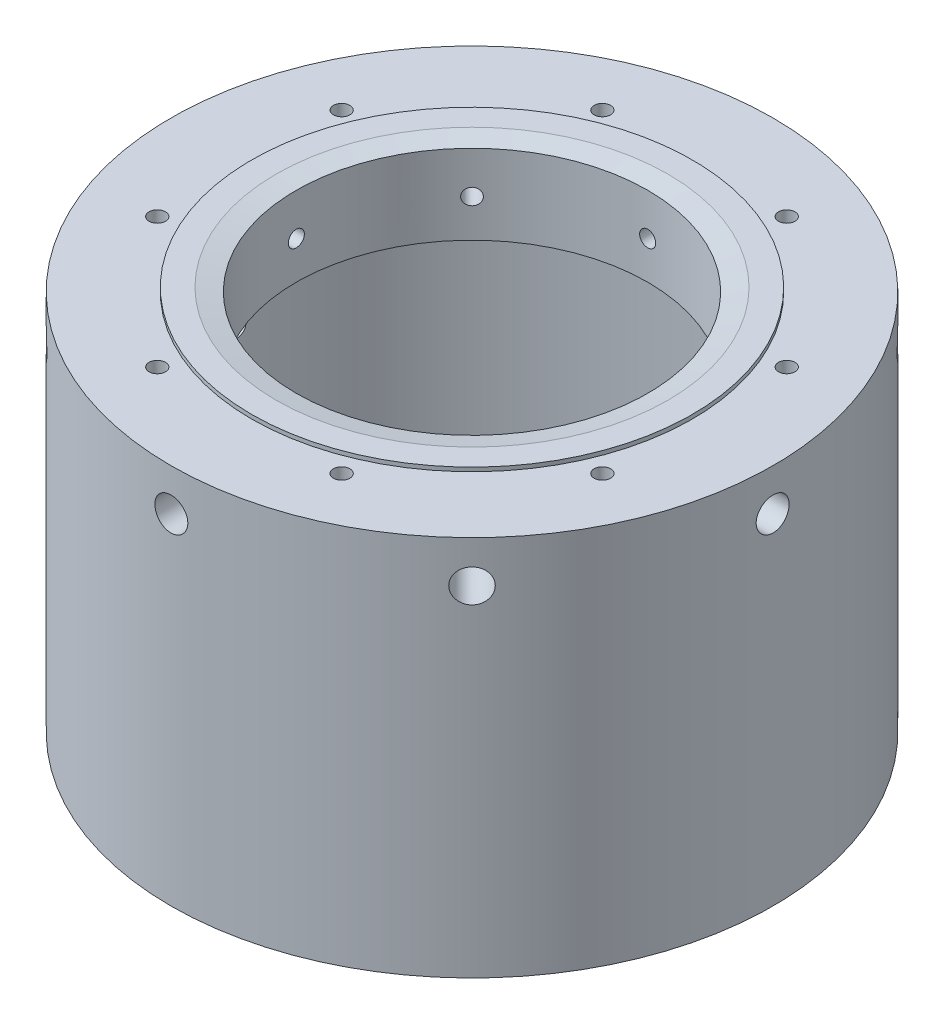
from build123d import *

# Parameters (mm, degrees)
CUT_EXTRUDE10_REACH             = 194.743
SKETCH8_R                       = 2
CUT_EXTRUDE10_DIRECTION_2_DEPTH = 193.743352674
SKETCH9_R                       = 4.1
CUT_EXTRUDE11_DEPTH             = 25.4
CUT_EXTRUDE7_START              = -19.833333
SKETCH6_R                       = 2.05
CUT_EXTRUDE7_DEPTH              = 15
CUT_EXTRUDE9_REACH              = 144.39
SKETCH7_R                       = 2.05
CIRPATTERN5_COUNT               = 8
BOSS_EXTRUDE4_OUTLINE_R         = 54.9
BOSS_EXTRUDE4_OUTLINE_R_2       = 43.8
BOSS_EXTRUDE4_DEPTH             = 1
CHAMFER1_SIZE                   = 5
CHAMFER1_SIZE_2                 = 1
CUT_EXTRUDE15_REACH             = 145.059
CUT_EXTRUDE15_END_RADIUS        = 75
SKETCH24_R                      = 2.55
CUT_EXTRUDE16_REACH             = 345.059
CUT_EXTRUDE16_END_RADIUS        = 74
CUT_EXTRUDE16_START             = -200
SKETCH25_R                      = 5.1
SKETCH25_R_2                    = 2.55
CUT_EXTRUDE17_DEPTH             = 3.3
CUT_EXTRUDE18_REACH             = 139.819
SKETCH27_R                      = 2.05
CIRPATTERN25_COUNT              = 12
CUT_EXTRUDE19_REACH             = 195.238
CUT_EXTRUDE19_END_RADIUS        = 70
SKETCH31_W                      = 2.5
SKETCH31_H                      = 5
CIRPATTERN26_COUNT              = 8
CUT_EXTRUDE20_DEPTH             = 2.5
SKETCH34_R                      = 1.55
CUT_EXTRUDE21_DEPTH             = 140.428297093


# Read off the part's stored shape, not the designer's step: Boss-Extrude4
with BuildPart() as part:
    # Sketch1 → Revolve1 (revolve)
    with BuildSketch(Plane(origin=(0, 0, 0), x_dir=(0, 0, -1), z_dir=(1, 0, 0))):
        Polygon((75, 0), (75, 95), (43.8, 95), (43.8, 75.166667), (70, 75.166667), (70, 8), (50, 8), (50, 0), align=None)
    revolve(axis=Axis((0, 0, 0), (0, 1, 0)))

    # Sketch8 → Cut-Extrude10 (cut, up to next)
    with BuildSketch(Plane(origin=(0, 0, -75), x_dir=(-1, 0, 0), z_dir=(0, 0, -1)), mode=Mode.PRIVATE) as cut_extrude10_sk1:
        with Locations(Location((0, 84.586667, 0), (0, 0, 270.000000054))):
            Circle(SKETCH8_R)
    cut_extrude10_tool1 = extrude(cut_extrude10_sk1.sketch, amount=-CUT_EXTRUDE10_REACH, mode=Mode.PRIVATE) & part.part
    cut_extrude10 = cut_extrude10_tool1.solids().sort_by_distance((0, 84.586667, -75))[0]
    add(cut_extrude10, mode=Mode.SUBTRACT)

    # Sketch8 → Cut-Extrude10 direction 2 (cut)
    with BuildSketch(Plane(origin=(0, 0, -75), x_dir=(-1, 0, 0), z_dir=(0, 0, -1))):
        with Locations(Location((0, 84.586667, 0), (0, 0, 270.000000054))):
            Circle(SKETCH8_R)
    cut_extrude10_direction_2 = extrude(amount=CUT_EXTRUDE10_DIRECTION_2_DEPTH, mode=Mode.SUBTRACT)

    # Sketch9 → Cut-Extrude11 (cut)
    with BuildSketch(Plane(origin=(0, 0, -75), x_dir=(-1, 0, 0), z_dir=(0, 0, -1))):
        with Locations((0, 84.586667)):
            Circle(SKETCH9_R)
    cut_extrude11 = extrude(amount=-CUT_EXTRUDE11_DEPTH, mode=Mode.SUBTRACT)

    # Sketch6 → Cut-Extrude7 (cut)
    with BuildSketch(Plane(origin=(0, 95, 0), x_dir=(1, 0, 0), z_dir=(0, 1, 0)).offset(CUT_EXTRUDE7_START)):
        Polygon((-19.740216226, 52.897057665), (-19.154618096, 56.954200522), (-22.375407812, 59.489914808), (-26.181795658, 57.968486236), (-26.767393788, 53.911343379), (-23.546604072, 51.375629094), align=None)
        with Locations(Location((-22.961005942, 55.432771951, 0), (0, 0, 90))):
            Circle(SKETCH6_R, mode=Mode.SUBTRACT)
    cut_extrude7 = extrude(amount=CUT_EXTRUDE7_DEPTH, mode=Mode.SUBTRACT)

    # Sketch7 → Cut-Extrude9 (cut, up to next)
    with BuildSketch(Plane(origin=(0, 95, 0), x_dir=(1, 0, 0), z_dir=(0, 1, 0)), mode=Mode.PRIVATE) as cut_extrude9_sk1:
        with Locations(Location((-22.961005942, 55.432771951, 0), (0, 0, 270))):
            Circle(SKETCH7_R)
    cut_extrude9_tool1 = extrude(cut_extrude9_sk1.sketch, amount=-CUT_EXTRUDE9_REACH, mode=Mode.PRIVATE) & part.part
    cut_extrude9 = cut_extrude9_tool1.solids().sort_by_distance((-22.961006, 95, -55.432772))[0]
    add(cut_extrude9, mode=Mode.SUBTRACT)

    # CirPattern5: Cut-Extrude10, Cut-Extrude10 direction 2, Cut-Extrude11 ×8 about axis
    cirpattern5_axis = Axis((0, 0, 0), (0, 1, 0))
    add([cut_extrude10.rotate(cirpattern5_axis, i * 360 / CIRPATTERN5_COUNT) for i in range(1, CIRPATTERN5_COUNT)], mode=Mode.SUBTRACT)
    add([cut_extrude10_direction_2.rotate(cirpattern5_axis, i * 360 / CIRPATTERN5_COUNT) for i in range(1, CIRPATTERN5_COUNT)], mode=Mode.SUBTRACT)
    add([cut_extrude11.rotate(cirpattern5_axis, i * 360 / CIRPATTERN5_COUNT) for i in range(1, CIRPATTERN5_COUNT)], mode=Mode.SUBTRACT)

    # Boss-Extrude4 outline → Boss-Extrude4 (add)
    with BuildSketch(Plane(origin=(0, 95, 0), x_dir=(1, 0, 0), z_dir=(0, 1, 0))):
        Circle(BOSS_EXTRUDE4_OUTLINE_R)
        Circle(BOSS_EXTRUDE4_OUTLINE_R_2, mode=Mode.SUBTRACT)
    extrude(amount=BOSS_EXTRUDE4_DEPTH)

    # Chamfer1
    # the kernel refuses this chamfer: 5, 1 mm, written as the material it takes off along each edge
    with BuildSketch(Plane(origin=(0, 96, 0), x_dir=(1, 0, 0), z_dir=(0, 0, 1))) as chamfer1_piece_1:
        Polygon((43.8 + CHAMFER1_SIZE, 0), (43.8, -CHAMFER1_SIZE_2), (43.8, 0), align=None)
    revolve(axis=Axis((0, 96, 0), (0, 1, 0)), mode=Mode.SUBTRACT)

    # Cut-Extrude15: up to this cylinder (the profile starts inside it)
    cut_extrude15_end = Plane(origin=(0, 47.5, 0), z_dir=(0, -1, 0)) * Cylinder(CUT_EXTRUDE15_END_RADIUS, 441.118, mode=Mode.PRIVATE)
    # Sketch24 → Cut-Extrude15 (cut, up to the surface)
    with BuildSketch(Plane(origin=(0, 0, 0), x_dir=(0, 0, -1), z_dir=(1, 0, 0)), mode=Mode.PRIVATE) as cut_extrude15_sk1:
        with Locations((-10, 47.5)):
            Circle(SKETCH24_R)
    cut_extrude15_tool1 = extrude(cut_extrude15_sk1.sketch, amount=-CUT_EXTRUDE15_REACH, mode=Mode.PRIVATE) & cut_extrude15_end
    add(cut_extrude15_tool1.solids().sort_by_distance((0, 47.5, 10))[0], mode=Mode.SUBTRACT)
    # Sketch24 → Cut-Extrude15 (cut, up to the surface)
    with BuildSketch(Plane(origin=(0, 0, 0), x_dir=(0, 0, -1), z_dir=(1, 0, 0)), mode=Mode.PRIVATE) as cut_extrude15_sk2:
        with Locations((10, 47.5)):
            Circle(SKETCH24_R)
    cut_extrude15_tool2 = extrude(cut_extrude15_sk2.sketch, amount=-CUT_EXTRUDE15_REACH, mode=Mode.PRIVATE) & cut_extrude15_end
    add(cut_extrude15_tool2.solids().sort_by_distance((0, 47.5, -10))[0], mode=Mode.SUBTRACT)

    # Cut-Extrude16: up to this cylinder (the profile starts outside it)
    cut_extrude16_end = Plane(origin=(0, 47.5, 0), z_dir=(0, -1, 0)) * Cylinder(CUT_EXTRUDE16_END_RADIUS, 839.118, mode=Mode.PRIVATE)
    # Sketch25 → Cut-Extrude16 (cut, up to the surface)
    with BuildSketch(Plane(origin=(0, 0, 0), x_dir=(0, 0, -1), z_dir=(1, 0, 0)).offset(CUT_EXTRUDE16_START), mode=Mode.PRIVATE) as cut_extrude16_sk1:
        with Locations(Location((10, 47.5, 0), (0, 0, 180))):
            Circle(SKETCH25_R)
        with Locations((10, 47.5)):
            Circle(SKETCH25_R_2, mode=Mode.SUBTRACT)
    cut_extrude16_tool1 = extrude(cut_extrude16_sk1.sketch, amount=CUT_EXTRUDE16_REACH, mode=Mode.PRIVATE) - cut_extrude16_end
    add(cut_extrude16_tool1.solids().sort_by_distance((-200, 47.5, -14.95575))[0], mode=Mode.SUBTRACT)
    # Sketch25 → Cut-Extrude16 (cut, up to the surface)
    with BuildSketch(Plane(origin=(0, 0, 0), x_dir=(0, 0, -1), z_dir=(1, 0, 0)).offset(CUT_EXTRUDE16_START), mode=Mode.PRIVATE) as cut_extrude16_sk2:
        with Locations(Location((-10, 47.5, 0), (0, 0, 180))):
            Circle(SKETCH25_R)
    cut_extrude16_tool2 = extrude(cut_extrude16_sk2.sketch, amount=CUT_EXTRUDE16_REACH, mode=Mode.PRIVATE) - cut_extrude16_end
    add(cut_extrude16_tool2.solids().sort_by_distance((-200, 47.5, 10))[0], mode=Mode.SUBTRACT)

    # Sketch26 → Cut-Extrude17 (cut)
    with BuildSketch(Plane(origin=(0, 8, 0), x_dir=(1, 0, 0), z_dir=(0, 1, 0))):
        Polygon((-24.149252646, 51.509584076), (-20.15754893, 52.442126181), (-18.969302226, 56.365314057), (-21.772759238, 59.355959826), (-25.764462954, 58.42341772), (-26.952709658, 54.500229845), align=None)
    cut_extrude17 = extrude(amount=-CUT_EXTRUDE17_DEPTH, mode=Mode.SUBTRACT)

    # Sketch27 → Cut-Extrude18 (cut, up to next)
    with BuildSketch(Plane(origin=(0, 8, 0), x_dir=(1, 0, 0), z_dir=(0, 1, 0)), mode=Mode.PRIVATE) as cut_extrude18_sk1:
        with Locations(Location((-22.961005942, 55.432771951, 0), (0, 0, 270))):
            Circle(SKETCH27_R)
    cut_extrude18_tool1 = extrude(cut_extrude18_sk1.sketch, amount=-CUT_EXTRUDE18_REACH, mode=Mode.PRIVATE) & part.part
    cut_extrude18 = cut_extrude18_tool1.solids().sort_by_distance((-22.961006, 8, -55.432772))[0]
    add(cut_extrude18, mode=Mode.SUBTRACT)

    # CirPattern25: Cut-Extrude17, Cut-Extrude18 ×12 about axis
    cirpattern25_axis = Axis((0, 0, 0), (0, 1, 0))
    add([cut_extrude17.rotate(cirpattern25_axis, i * 360 / CIRPATTERN25_COUNT) for i in range(1, CIRPATTERN25_COUNT)], mode=Mode.SUBTRACT)
    add([cut_extrude18.rotate(cirpattern25_axis, i * 360 / CIRPATTERN25_COUNT) for i in range(1, CIRPATTERN25_COUNT)], mode=Mode.SUBTRACT)

    # Cut-Extrude19: up to this cylinder (the profile starts outside it)
    cut_extrude19_end = Plane(origin=(0, 43.125, 0), z_dir=(0, -1, 0)) * Cylinder(CUT_EXTRUDE19_END_RADIUS, 575.226, mode=Mode.PRIVATE)
    # Sketch31 → Cut-Extrude19 (cut, up to the surface)
    with BuildSketch(Plane(origin=(0, 0, -75), x_dir=(-1, 0, 0), z_dir=(0, 0, -1)), mode=Mode.PRIVATE) as cut_extrude19_sk1:
        with Locations((-13.75, 65)):
            Rectangle(SKETCH31_W, SKETCH31_H)
    cut_extrude19_tool1 = extrude(cut_extrude19_sk1.sketch, amount=-CUT_EXTRUDE19_REACH, mode=Mode.PRIVATE) - cut_extrude19_end
    add(cut_extrude19_tool1.solids().sort_by_distance((13.75, 65, -75))[0], mode=Mode.SUBTRACT)
    # Sketch31 → Cut-Extrude19 (cut, up to the surface)
    with BuildSketch(Plane(origin=(0, 0, -75), x_dir=(-1, 0, 0), z_dir=(0, 0, -1)), mode=Mode.PRIVATE) as cut_extrude19_sk2:
        with Locations((13.75, 65)):
            Rectangle(SKETCH31_W, SKETCH31_H)
    cut_extrude19_tool2 = extrude(cut_extrude19_sk2.sketch, amount=-CUT_EXTRUDE19_REACH, mode=Mode.PRIVATE) - cut_extrude19_end
    add(cut_extrude19_tool2.solids().sort_by_distance((-13.75, 65, -75))[0], mode=Mode.SUBTRACT)
    # Sketch31 → Cut-Extrude19 (cut, up to the surface)
    with BuildSketch(Plane(origin=(0, 0, -75), x_dir=(-1, 0, 0), z_dir=(0, 0, -1)), mode=Mode.PRIVATE) as cut_extrude19_sk3:
        with Locations((-13.75, 21.25)):
            Rectangle(SKETCH31_W, SKETCH31_H)
    cut_extrude19_tool3 = extrude(cut_extrude19_sk3.sketch, amount=-CUT_EXTRUDE19_REACH, mode=Mode.PRIVATE) - cut_extrude19_end
    add(cut_extrude19_tool3.solids().sort_by_distance((13.75, 21.25, -75))[0], mode=Mode.SUBTRACT)
    # Sketch31 → Cut-Extrude19 (cut, up to the surface)
    with BuildSketch(Plane(origin=(0, 0, -75), x_dir=(-1, 0, 0), z_dir=(0, 0, -1)), mode=Mode.PRIVATE) as cut_extrude19_sk4:
        with Locations((13.75, 21.25)):
            Rectangle(SKETCH31_W, SKETCH31_H)
    cut_extrude19_tool4 = extrude(cut_extrude19_sk4.sketch, amount=-CUT_EXTRUDE19_REACH, mode=Mode.PRIVATE) - cut_extrude19_end
    add(cut_extrude19_tool4.solids().sort_by_distance((-13.75, 21.25, -75))[0], mode=Mode.SUBTRACT)

    # CirPattern26: Cut-Extrude7, Cut-Extrude9 ×8 about axis
    cirpattern26_axis = Axis((0, 0, 0), (0, 1, 0))
    add([cut_extrude7.rotate(cirpattern26_axis, i * 360 / CIRPATTERN26_COUNT) for i in range(1, CIRPATTERN26_COUNT)], mode=Mode.SUBTRACT)
    add([cut_extrude9.rotate(cirpattern26_axis, i * 360 / CIRPATTERN26_COUNT) for i in range(1, CIRPATTERN26_COUNT)], mode=Mode.SUBTRACT)

    # Sketch33 → Cut-Extrude20 (cut)
    with BuildSketch(Plane(origin=(0, 8, 0), x_dir=(1, 0, 0), z_dir=(0, 1, 0))):
        Polygon((-46.427889985, -33.512933516), (-49.623665163, -34.003192988), (-50.796975595, -37.015945212), (-48.77451085, -39.538437965), (-45.578735672, -39.048178493), (-44.40542524, -36.035426269), align=None)
    extrude(amount=-CUT_EXTRUDE20_DEPTH, mode=Mode.SUBTRACT)

    # Sketch34 → Cut-Extrude21 (cut, through all)
    with BuildSketch(Plane(origin=(0, 5.5, 0), x_dir=(1, 0, 0), z_dir=(0, 1, 0))):
        with Locations(Location((-47.601200417, -36.525685741, 0), (0, 0, 270))):
            Circle(SKETCH34_R)
    extrude(amount=-CUT_EXTRUDE21_DEPTH, mode=Mode.SUBTRACT)


solid = part.part
